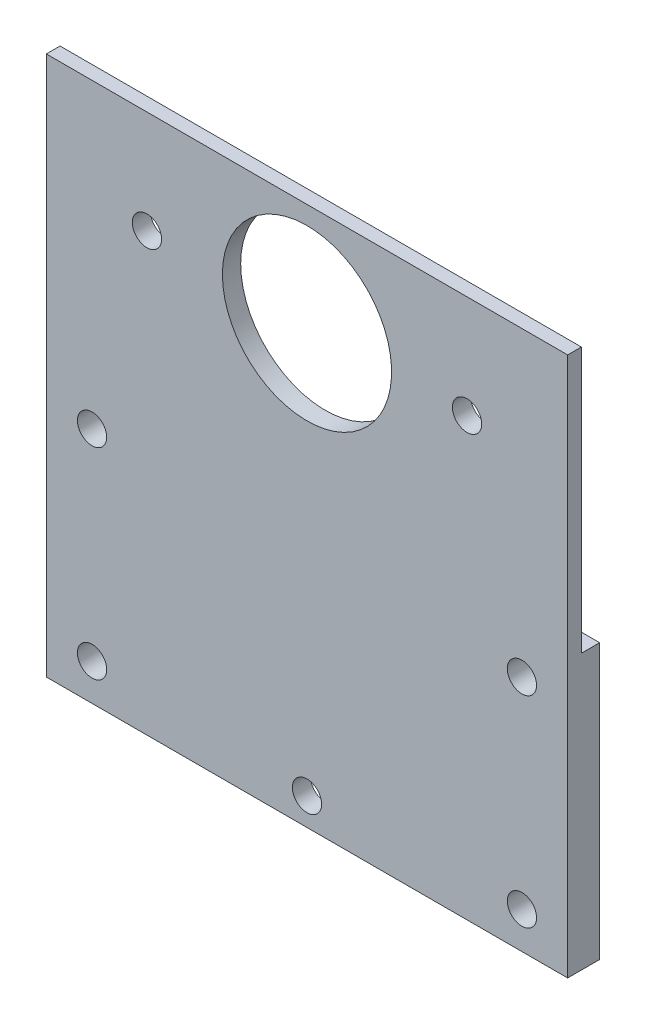
from build123d import *

# Parameters (mm, degrees)
GRUNDK_RPER_DEPTH               = 2
SKIZZE2_R                       = 9.25
SKIZZE2_R_2                     = 1.6000000000000008
BOHRUNGEN_KUGELROLLER_DEPTH     = 66.55341333599647
AUFSATZ_GETRIEBEHALTER_DEPTH    = 2
SKIZZE4_R                       = 1.6000000000000019
BOHRUNGEN_GETRIEBEHALTER_DEPTH  = 66.64487794184707
SKIZZE5_R                       = 1.6
BOHRUNG_HALTERUNG_DEPTH         = 66.55341333599647
SCHNITT_LINEAR_AUSTRAGEN4_DEPTH = 1
VERRUNDUNG_AUSSCHNITTE_R        = 1
VERRUNDUNG4_R                   = 1
FASE1_SIZE                      = 0.5


# Some blends are built 0.0001 mm under size
with BuildPart() as part:
    # Skizze1 → Grundkörper (new body)
    with BuildSketch(Plane.XY):
        Polygon((-28.500000000000004, 59), (28.500000000000004, 59), (28.500000000000007, 0), (-28.500000000000007, 0), align=None)
    extrude(amount=GRUNDK_RPER_DEPTH)

    # Skizze2 → Bohrungen_Kugelroller (cut, through all)
    with BuildSketch(Plane(origin=(0, 0, 0), x_dir=(-1, 0, 0), z_dir=(0, 0, -1))):
        with Locations((0, 47.75)):
            Circle(SKIZZE2_R)
        with Locations((-17.5, 47.75)):
            Circle(SKIZZE2_R_2)
        with Locations(Location((17.5, 47.75, 0), (0, 0, 180))):
            Circle(SKIZZE2_R_2)
    extrude(amount=-BOHRUNGEN_KUGELROLLER_DEPTH, mode=Mode.SUBTRACT)

    # Skizze3 → Aufsatz_Getriebehalter (add)
    with BuildSketch(Plane(origin=(0, 0, 0), x_dir=(-1, 0, 0), z_dir=(0, 0, -1))):
        Polygon((-28.500000000000007, 30), (-18.50000000000001, 30), (-18.500000000000007, 0), (-28.500000000000007, 0), align=None)
        Polygon((28.500000000000007, 0), (18.500000000000007, 0), (18.50000000000001, 30), (28.500000000000007, 30), align=None)
    extrude(amount=AUFSATZ_GETRIEBEHALTER_DEPTH)

    # Skizze4 → Bohrungen_Getriebehalter (cut, through all)
    with BuildSketch(Plane(origin=(0, 0, -2), x_dir=(-1, 0, 0), z_dir=(0, 0, -1))):
        with Locations((-23.500000000000007, 25.999999999999996)):
            Circle(SKIZZE4_R)
        with Locations(Location((23.500000000000014, 26.000000000000004, 0), (0, 0, 180))):
            Circle(SKIZZE4_R)
        with Locations((23.500000000000018, 4.000000000000007)):
            Circle(SKIZZE4_R)
        with Locations(Location((-23.500000000000004, 4.0000000000000036, 0), (0, 0, 180))):
            Circle(SKIZZE4_R)
    extrude(amount=-BOHRUNGEN_GETRIEBEHALTER_DEPTH, mode=Mode.SUBTRACT)

    # Skizze5 → Bohrung_Halterung (cut, through all)
    with BuildSketch(Plane(origin=(0, 0, 0), x_dir=(-1, 0, 0), z_dir=(0, 0, -1))):
        with Locations((7.14e-15, 3.0000000000000027)):
            Circle(SKIZZE5_R)
    extrude(amount=-BOHRUNG_HALTERUNG_DEPTH, mode=Mode.SUBTRACT)

    # Skizze8 → Schnitt-Linear austragen4 (cut)
    with BuildSketch(Plane(origin=(0, 0, 0), x_dir=(-1, 0, 0), z_dir=(0, 0, -1))):
        Polygon((-16.500000000000007, 13.000000000000002), (-16.500000000000007, 3), (-4, 3), (-4, 7.500000000000002), align=None)
        Polygon((-4, 9.500000000000002), (-4, 20.5), (-16.500000000000004, 15.000000000000002), align=None)
        Polygon((-16.500000000000007, 28), (-16.500000000000007, 17), (-4.000000000000002, 22.500000000000007), align=None)
        Polygon((-16.500000000000007, 30), (-4.000000000000005, 24.500000000000007), (-4.000000000000005, 35.50000000000001), align=None)
        Polygon((-26.17803843608435, 32), (-16.500000000000007, 32), (-4.000000000000005, 37.50000000000001), (-26.17803843608435, 37.50000000000001), align=None)
        Polygon((26.17803843608435, 37.50000000000001), (26.17803843608435, 32), (16.500000000000007, 32), (4.000000000000005, 37.50000000000001), align=None)
        Polygon((4.000000000000005, 35.50000000000001), (16.500000000000007, 30), (4.000000000000005, 24.500000000000007), align=None)
        Polygon((4.000000000000002, 22.500000000000007), (16.500000000000007, 28), (16.500000000000007, 17), align=None)
        Polygon((16.500000000000004, 15.000000000000002), (4, 9.500000000000002), (4, 20.5), align=None)
        Polygon((4, 7.500000000000002), (16.500000000000007, 13.000000000000002), (16.500000000000007, 3), (4, 3), align=None)
    extrude(amount=-SCHNITT_LINEAR_AUSTRAGEN4_DEPTH, mode=Mode.SUBTRACT)

    # Verrundung_Ausschnitte
    verrundung_ausschnitte_edges = [part.edges().sort_by_distance(p)[0] for p in [
        (-26.17803843608435, 34.75, 1),
        (-21.33901921804218, 32, 1),
        (-10.250000000000007, 34.75, 1),
        (-15.089019218042177, 37.50000000000001, 1),
        (-10.250000000000007, 32.75, 1),
        (-10.250000000000007, 27.250000000000004, 1),
        (-4.000000000000005, 30.000000000000007, 1),
        (-10.250000000000004, 25.250000000000004, 1),
        (-16.500000000000007, 22.5, 1),
        (-10.250000000000004, 19.750000000000004, 1),
        (-10.250000000000002, 12.250000000000002, 1),
        (-4, 15, 1),
        (-10.250000000000002, 17.75, 1),
        (-10.250000000000004, 10.250000000000002, 1),
        (-16.500000000000007, 8, 1),
        (-10.250000000000004, 3, 1),
        (-4, 5.250000000000001, 1),
        (4, 5.250000000000001, 1),
        (10.250000000000004, 3, 1),
        (16.500000000000007, 8, 1),
        (10.250000000000004, 10.250000000000002, 1),
        (10.250000000000002, 17.75, 1),
        (4, 15, 1),
        (10.250000000000002, 12.250000000000002, 1),
        (10.250000000000004, 19.750000000000004, 1),
        (16.500000000000007, 22.5, 1),
        (10.250000000000004, 25.250000000000004, 1),
        (4.000000000000005, 30.000000000000007, 1),
        (10.250000000000007, 27.250000000000004, 1),
        (10.250000000000007, 32.75, 1),
        (10.250000000000007, 34.75, 1),
        (21.33901921804218, 32, 1),
        (26.17803843608435, 34.75, 1),
        (15.089019218042177, 37.50000000000001, 1),
    ]]
    fillet(verrundung_ausschnitte_edges, radius=VERRUNDUNG_AUSSCHNITTE_R - 0.0001)  # a hair under: the kernel refuses the full size

    # Verrundung4
    # the kernel refuses this fillet: 1 mm, written as the material it adds along each edge
    with BuildSketch(Plane(origin=(-16.710272778863217, 33, 1), x_dir=(0, -1, 0), z_dir=(-1, 0, 0))) as verrundung4_piece_1:
        with BuildLine():
            CenterArc((9.999999999999e-05, -0.9999), 0.9999, 0, 90)
            Line((1, -0.9999), (1, 0))
            Line((1, 0), (9.999999999999e-05, 0))
        make_face()
    revolve(axis=Axis((-16.710272778863217, 33, 1), (0, 0, 1)), revolution_arc=23.749494492866784)
    with BuildSketch(Plane(origin=(-8.755727324317757, 36.50000000000001, 1), x_dir=(0.4027386142660173, -0.9153150324227655, 0), z_dir=(-0.9153150324227655, -0.4027386142660173, 0))) as verrundung4_piece_2:
        with BuildLine():
            CenterArc((9.999999999999e-05, -0.9999), 0.9999, 0, 90)
            Line((1, -0.9999), (1, 0))
            Line((1, 0), (9.999999999999e-05, 0))
        make_face()
    revolve(axis=Axis((-8.755727324317757, 36.50000000000001, 1), (0, 0, 1)), revolution_arc=156.25050550713323)
    with BuildSketch(Plane(origin=(-25.17803843608435, 33, 1), x_dir=(-1, 0, 0), z_dir=(0, 1, 0))) as verrundung4_piece_3:
        with BuildLine():
            CenterArc((9.999999999999e-05, -0.9999), 0.9999, 0, 90)
            Line((1, -0.9999), (1, 0))
            Line((1, 0), (9.999999999999e-05, 0))
        make_face()
    revolve(axis=Axis((-25.17803843608435, 33, 1), (0, 0, 1)), revolution_arc=90)
    with BuildSketch(Plane(origin=(-25.17803843608435, 36.50000000000001, 1), x_dir=(0, 1, 0), z_dir=(1, 0, 0))) as verrundung4_piece_4:
        with BuildLine():
            CenterArc((9.999999999999e-05, -0.9999), 0.9999, 0, 90)
            Line((1, -0.9999), (1, 0))
            Line((1, 0), (9.999999999999e-05, 0))
        make_face()
    revolve(axis=Axis((-25.17803843608435, 36.50000000000001, 1), (0, 0, 1)), revolution_arc=90)
    with BuildSketch(Plane(origin=(-5.000000000000005, 26.03252002269982, 1), x_dir=(-0.4027386142660164, -0.9153150324227659, 0), z_dir=(-0.9153150324227659, 0.4027386142660164, 0))) as verrundung4_piece_5:
        with BuildLine():
            CenterArc((9.999999999999e-05, -0.9999), 0.9999, 0, 90)
            Line((1, -0.9999), (1, 0))
            Line((1, 0), (9.999999999999e-05, 0))
        make_face()
    revolve(axis=Axis((-5.000000000000005, 26.03252002269982, 1), (0, 0, 1)), revolution_arc=113.74949449286673)
    with BuildSketch(Plane(origin=(-14.016999948409522, 30, 1), x_dir=(-0.4027386142660173, 0.9153150324227655, 0), z_dir=(0.9153150324227655, 0.4027386142660173, 0))) as verrundung4_piece_6:
        with BuildLine():
            CenterArc((9.999999999999e-05, -0.9999), 0.9999, 0, 90)
            Line((1, -0.9999), (1, 0))
            Line((1, 0), (9.999999999999e-05, 0))
        make_face()
    revolve(axis=Axis((-14.016999948409522, 30, 1), (0, 0, 1)), revolution_arc=132.5010110142665)
    with BuildSketch(Plane(origin=(-5.000000000000005, 33.967479977300194, 1), x_dir=(1, 0, 0), z_dir=(0, -1, 0))) as verrundung4_piece_7:
        with BuildLine():
            CenterArc((9.999999999999e-05, -0.9999), 0.9999, 0, 90)
            Line((1, -0.9999), (1, 0))
            Line((1, 0), (9.999999999999e-05, 0))
        make_face()
    revolve(axis=Axis((-5.000000000000005, 33.967479977300194, 1), (0, 0, 1)), revolution_arc=113.74949449286679)
    with BuildSketch(Plane(origin=(-15.500000000000005, 18.532520022699813, 1), x_dir=(-1, 0, 0), z_dir=(0, 1, 0))) as verrundung4_piece_8:
        with BuildLine():
            CenterArc((9.999999999999e-05, -0.9999), 0.9999, 0, 90)
            Line((1, -0.9999), (1, 0))
            Line((1, 0), (9.999999999999e-05, 0))
        make_face()
    revolve(axis=Axis((-15.500000000000005, 18.532520022699813, 1), (0, 0, 1)), revolution_arc=113.74949449286679)
    with BuildSketch(Plane(origin=(-15.500000000000007, 26.467479977300187, 1), x_dir=(0.4027386142660163, 0.9153150324227659, 0), z_dir=(0.9153150324227659, -0.4027386142660163, 0))) as verrundung4_piece_9:
        with BuildLine():
            CenterArc((9.999999999999e-05, -0.9999), 0.9999, 0, 90)
            Line((1, -0.9999), (1, 0))
            Line((1, 0), (9.999999999999e-05, 0))
        make_face()
    revolve(axis=Axis((-15.500000000000007, 26.467479977300187, 1), (0, 0, 1)), revolution_arc=113.74949449286673)
    with BuildSketch(Plane(origin=(-6.4830000515904835, 22.500000000000007, 1), x_dir=(0.4027386142660172, -0.9153150324227656, 0), z_dir=(-0.9153150324227656, -0.4027386142660172, 0))) as verrundung4_piece_10:
        with BuildLine():
            CenterArc((9.999999999999e-05, -0.9999), 0.9999, 0, 90)
            Line((1, -0.9999), (1, 0))
            Line((1, 0), (9.999999999999e-05, 0))
        make_face()
    revolve(axis=Axis((-6.4830000515904835, 22.500000000000007, 1), (0, 0, 1)), revolution_arc=132.5010110142665)
    with BuildSketch(Plane(origin=(-5, 18.96747997730019, 1), x_dir=(1, 0, 0), z_dir=(0, -1, 0))) as verrundung4_piece_11:
        with BuildLine():
            CenterArc((9.999999999999e-05, -0.9999), 0.9999, 0, 90)
            Line((1, -0.9999), (1, 0))
            Line((1, 0), (9.999999999999e-05, 0))
        make_face()
    revolve(axis=Axis((-5, 18.96747997730019, 1), (0, 0, 1)), revolution_arc=113.74949449286675)
    with BuildSketch(Plane(origin=(-5, 11.032520022699815, 1), x_dir=(-0.40273861426601676, -0.9153150324227657, 0), z_dir=(-0.9153150324227657, 0.40273861426601676, 0))) as verrundung4_piece_12:
        with BuildLine():
            CenterArc((9.999999999999e-05, -0.9999), 0.9999, 0, 90)
            Line((1, -0.9999), (1, 0))
            Line((1, 0), (9.999999999999e-05, 0))
        make_face()
    revolve(axis=Axis((-5, 11.032520022699815, 1), (0, 0, 1)), revolution_arc=113.74949449286676)
    with BuildSketch(Plane(origin=(-14.016999948409518, 15.000000000000002, 1), x_dir=(-0.4027386142660167, 0.9153150324227658, 0), z_dir=(0.9153150324227658, 0.4027386142660167, 0))) as verrundung4_piece_13:
        with BuildLine():
            CenterArc((9.999999999999e-05, -0.9999), 0.9999, 0, 90)
            Line((1, -0.9999), (1, 0))
            Line((1, 0), (9.999999999999e-05, 0))
        make_face()
    revolve(axis=Axis((-14.016999948409518, 15.000000000000002, 1), (0, 0, 1)), revolution_arc=132.5010110142665)
    with BuildSketch(Plane(origin=(-15.500000000000007, 4, 1), x_dir=(-1, 0, 0), z_dir=(0, 1, 0))) as verrundung4_piece_14:
        with BuildLine():
            CenterArc((9.999999999999e-05, -0.9999), 0.9999, 0, 90)
            Line((1, -0.9999), (1, 0))
            Line((1, 0), (9.999999999999e-05, 0))
        make_face()
    revolve(axis=Axis((-15.500000000000007, 4, 1), (0, 0, 1)), revolution_arc=90)
    with BuildSketch(Plane(origin=(-5, 4, 1), x_dir=(0, -1, 0), z_dir=(-1, 0, 0))) as verrundung4_piece_15:
        with BuildLine():
            CenterArc((9.999999999999e-05, -0.9999), 0.9999, 0, 90)
            Line((1, -0.9999), (1, 0))
            Line((1, 0), (9.999999999999e-05, 0))
        make_face()
    revolve(axis=Axis((-5, 4, 1), (0, 0, 1)), revolution_arc=90)
    with BuildSketch(Plane(origin=(-15.500000000000007, 11.46747997730019, 1), x_dir=(0.40273861426601665, 0.9153150324227657, 0), z_dir=(0.9153150324227657, -0.40273861426601665, 0))) as verrundung4_piece_16:
        with BuildLine():
            CenterArc((9.999999999999e-05, -0.9999), 0.9999, 0, 90)
            Line((1, -0.9999), (1, 0))
            Line((1, 0), (9.999999999999e-05, 0))
        make_face()
    revolve(axis=Axis((-15.500000000000007, 11.46747997730019, 1), (0, 0, 1)), revolution_arc=113.74949449286675)
    with BuildSketch(Plane(origin=(-5, 6.847479977300189, 1), x_dir=(1, 0, 0), z_dir=(0, -1, 0))) as verrundung4_piece_17:
        with BuildLine():
            CenterArc((9.999999999999e-05, -0.9999), 0.9999, 0, 90)
            Line((1, -0.9999), (1, 0))
            Line((1, 0), (9.999999999999e-05, 0))
        make_face()
    revolve(axis=Axis((-5, 6.847479977300189, 1), (0, 0, 1)), revolution_arc=66.25050550713325)
    with BuildSketch(Plane(origin=(15.500000000000007, 4, 1), x_dir=(0, -1, 0), z_dir=(-1, 0, 0))) as verrundung4_piece_18:
        with BuildLine():
            CenterArc((9.999999999999e-05, -0.9999), 0.9999, 0, 90)
            Line((1, -0.9999), (1, 0))
            Line((1, 0), (9.999999999999e-05, 0))
        make_face()
    revolve(axis=Axis((15.500000000000007, 4, 1), (0, 0, 1)), revolution_arc=90)
    with BuildSketch(Plane(origin=(15.500000000000007, 11.46747997730019, 1), x_dir=(1, 0, 0), z_dir=(0, -1, 0))) as verrundung4_piece_19:
        with BuildLine():
            CenterArc((9.999999999999e-05, -0.9999), 0.9999, 0, 90)
            Line((1, -0.9999), (1, 0))
            Line((1, 0), (9.999999999999e-05, 0))
        make_face()
    revolve(axis=Axis((15.500000000000007, 11.46747997730019, 1), (0, 0, 1)), revolution_arc=113.74949449286675)
    with BuildSketch(Plane(origin=(5, 4, 1), x_dir=(-1, 0, 0), z_dir=(0, 1, 0))) as verrundung4_piece_20:
        with BuildLine():
            CenterArc((9.999999999999e-05, -0.9999), 0.9999, 0, 90)
            Line((1, -0.9999), (1, 0))
            Line((1, 0), (9.999999999999e-05, 0))
        make_face()
    revolve(axis=Axis((5, 4, 1), (0, 0, 1)), revolution_arc=90)
    with BuildSketch(Plane(origin=(5.000000000000001, 6.847479977300189, 1), x_dir=(-0.40273861426601665, 0.9153150324227657, 0), z_dir=(0.9153150324227657, 0.40273861426601665, 0))) as verrundung4_piece_21:
        with BuildLine():
            CenterArc((9.999999999999e-05, -0.9999), 0.9999, 0, 90)
            Line((1, -0.9999), (1, 0))
            Line((1, 0), (9.999999999999e-05, 0))
        make_face()
    revolve(axis=Axis((5.000000000000001, 6.847479977300189, 1), (0, 0, 1)), revolution_arc=66.25050550713325)
    with BuildSketch(Plane(origin=(5, 11.032520022699815, 1), x_dir=(-1, 0, 0), z_dir=(0, 1, 0))) as verrundung4_piece_22:
        with BuildLine():
            CenterArc((9.999999999999e-05, -0.9999), 0.9999, 0, 90)
            Line((1, -0.9999), (1, 0))
            Line((1, 0), (9.999999999999e-05, 0))
        make_face()
    revolve(axis=Axis((5, 11.032520022699815, 1), (0, 0, 1)), revolution_arc=113.74949449286676)
    with BuildSketch(Plane(origin=(5, 18.967479977300187, 1), x_dir=(0.4027386142660167, 0.9153150324227658, 0), z_dir=(0.9153150324227658, -0.4027386142660167, 0))) as verrundung4_piece_23:
        with BuildLine():
            CenterArc((9.999999999999e-05, -0.9999), 0.9999, 0, 90)
            Line((1, -0.9999), (1, 0))
            Line((1, 0), (9.999999999999e-05, 0))
        make_face()
    revolve(axis=Axis((5, 18.967479977300187, 1), (0, 0, 1)), revolution_arc=113.74949449286675)
    with BuildSketch(Plane(origin=(14.016999948409518, 15.000000000000002, 1), x_dir=(0.40273861426601676, -0.9153150324227657, 0), z_dir=(-0.9153150324227657, -0.40273861426601676, 0))) as verrundung4_piece_24:
        with BuildLine():
            CenterArc((9.999999999999e-05, -0.9999), 0.9999, 0, 90)
            Line((1, -0.9999), (1, 0))
            Line((1, 0), (9.999999999999e-05, 0))
        make_face()
    revolve(axis=Axis((14.016999948409518, 15.000000000000002, 1), (0, 0, 1)), revolution_arc=132.5010110142665)
    with BuildSketch(Plane(origin=(15.500000000000007, 26.467479977300187, 1), x_dir=(1, 0, 0), z_dir=(0, -1, 0))) as verrundung4_piece_25:
        with BuildLine():
            CenterArc((9.999999999999e-05, -0.9999), 0.9999, 0, 90)
            Line((1, -0.9999), (1, 0))
            Line((1, 0), (9.999999999999e-05, 0))
        make_face()
    revolve(axis=Axis((15.500000000000007, 26.467479977300187, 1), (0, 0, 1)), revolution_arc=113.74949449286673)
    with BuildSketch(Plane(origin=(15.500000000000007, 18.532520022699813, 1), x_dir=(-0.4027386142660172, -0.9153150324227656, 0), z_dir=(-0.9153150324227656, 0.4027386142660172, 0))) as verrundung4_piece_26:
        with BuildLine():
            CenterArc((9.999999999999e-05, -0.9999), 0.9999, 0, 90)
            Line((1, -0.9999), (1, 0))
            Line((1, 0), (9.999999999999e-05, 0))
        make_face()
    revolve(axis=Axis((15.500000000000007, 18.532520022699813, 1), (0, 0, 1)), revolution_arc=113.74949449286679)
    with BuildSketch(Plane(origin=(6.4830000515904835, 22.500000000000007, 1), x_dir=(-0.4027386142660163, 0.9153150324227659, 0), z_dir=(0.9153150324227659, 0.4027386142660163, 0))) as verrundung4_piece_27:
        with BuildLine():
            CenterArc((9.999999999999e-05, -0.9999), 0.9999, 0, 90)
            Line((1, -0.9999), (1, 0))
            Line((1, 0), (9.999999999999e-05, 0))
        make_face()
    revolve(axis=Axis((6.4830000515904835, 22.500000000000007, 1), (0, 0, 1)), revolution_arc=132.5010110142665)
    with BuildSketch(Plane(origin=(14.016999948409522, 30, 1), x_dir=(0.4027386142660164, -0.9153150324227659, 0), z_dir=(-0.9153150324227659, -0.4027386142660164, 0))) as verrundung4_piece_28:
        with BuildLine():
            CenterArc((9.999999999999e-05, -0.9999), 0.9999, 0, 90)
            Line((1, -0.9999), (1, 0))
            Line((1, 0), (9.999999999999e-05, 0))
        make_face()
    revolve(axis=Axis((14.016999948409522, 30, 1), (0, 0, 1)), revolution_arc=132.5010110142665)
    with BuildSketch(Plane(origin=(5.000000000000003, 26.032520022699817, 1), x_dir=(-1, 0, 0), z_dir=(0, 1, 0))) as verrundung4_piece_29:
        with BuildLine():
            CenterArc((9.999999999999e-05, -0.9999), 0.9999, 0, 90)
            Line((1, -0.9999), (1, 0))
            Line((1, 0), (9.999999999999e-05, 0))
        make_face()
    revolve(axis=Axis((5.000000000000003, 26.032520022699817, 1), (0, 0, 1)), revolution_arc=113.74949449286673)
    with BuildSketch(Plane(origin=(5.000000000000005, 33.967479977300194, 1), x_dir=(0.4027386142660173, 0.9153150324227655, 0), z_dir=(0.9153150324227655, -0.4027386142660173, 0))) as verrundung4_piece_30:
        with BuildLine():
            CenterArc((9.999999999999e-05, -0.9999), 0.9999, 0, 90)
            Line((1, -0.9999), (1, 0))
            Line((1, 0), (9.999999999999e-05, 0))
        make_face()
    revolve(axis=Axis((5.000000000000005, 33.967479977300194, 1), (0, 0, 1)), revolution_arc=113.74949449286679)
    with BuildSketch(Plane(origin=(25.17803843608435, 33, 1), x_dir=(0, -1, 0), z_dir=(-1, 0, 0))) as verrundung4_piece_31:
        with BuildLine():
            CenterArc((9.999999999999e-05, -0.9999), 0.9999, 0, 90)
            Line((1, -0.9999), (1, 0))
            Line((1, 0), (9.999999999999e-05, 0))
        make_face()
    revolve(axis=Axis((25.17803843608435, 33, 1), (0, 0, 1)), revolution_arc=90)
    with BuildSketch(Plane(origin=(25.17803843608435, 36.50000000000001, 1), x_dir=(1, 0, 0), z_dir=(0, -1, 0))) as verrundung4_piece_32:
        with BuildLine():
            CenterArc((9.999999999999e-05, -0.9999), 0.9999, 0, 90)
            Line((1, -0.9999), (1, 0))
            Line((1, 0), (9.999999999999e-05, 0))
        make_face()
    revolve(axis=Axis((25.17803843608435, 36.50000000000001, 1), (0, 0, 1)), revolution_arc=90)
    with BuildSketch(Plane(origin=(16.710272778863217, 33, 1), x_dir=(-0.4027386142660173, -0.9153150324227655, 0), z_dir=(-0.9153150324227655, 0.4027386142660173, 0))) as verrundung4_piece_33:
        with BuildLine():
            CenterArc((9.999999999999e-05, -0.9999), 0.9999, 0, 90)
            Line((1, -0.9999), (1, 0))
            Line((1, 0), (9.999999999999e-05, 0))
        make_face()
    revolve(axis=Axis((16.710272778863217, 33, 1), (0, 0, 1)), revolution_arc=23.749494492866784)
    with BuildSketch(Plane(origin=(8.755727324317757, 36.50000000000001, 1), x_dir=(0, 1, 0), z_dir=(1, 0, 0))) as verrundung4_piece_34:
        with BuildLine():
            CenterArc((9.999999999999e-05, -0.9999), 0.9999, 0, 90)
            Line((1, -0.9999), (1, 0))
            Line((1, 0), (9.999999999999e-05, 0))
        make_face()
    revolve(axis=Axis((8.755727324317757, 36.50000000000001, 1), (0, 0, 1)), revolution_arc=156.25050550713323)
    with BuildSketch(Plane(origin=(4.000000000000005, 37.50000000000001, 0), x_dir=(0.9153150324227651, -0.4027386142660177, 0), z_dir=(0, 0, 1))) as verrundung4_piece_35:
        with BuildLine():
            CenterArc((VERRUNDUNG4_R * 4.75572732432, VERRUNDUNG4_R), VERRUNDUNG4_R, 113.74949449286683, 156.25050550713325)
            Line((VERRUNDUNG4_R * 4.35298871005, VERRUNDUNG4_R * 1.91531503242), (0, 0))
            Line((0, 0), (VERRUNDUNG4_R * 4.75572732432, 4e-17))
        make_face()
    extrude(amount=1.0000000000000002)
    with BuildSketch(Plane(origin=(16.500000000000007, 32, 0), x_dir=(1, 0, 0), z_dir=(0, 0, 1))) as verrundung4_piece_36:
        with BuildLine():
            CenterArc((VERRUNDUNG4_R * 0.210272778863, VERRUNDUNG4_R), VERRUNDUNG4_R, 246.25050550713328, 23.74949449286669)
            Line((-VERRUNDUNG4_R * 0.192465835403, VERRUNDUNG4_R * 0.0846849675772), (0, 0))
            Line((0, 0), (VERRUNDUNG4_R * 0.210272778863, 0))
        make_face()
    extrude(amount=1.0000000000000002)
    with BuildSketch(Plane(origin=(26.17803843608435, 37.50000000000001, 0), x_dir=(-1, 0, 0), z_dir=(0, 0, 1)), Plane(origin=(-26.17803843608435, 32, 0), x_dir=(1, 0, 0), z_dir=(0, 0, 1))) as verrundung4_piece_37:
        with BuildLine():
            CenterArc((VERRUNDUNG4_R, VERRUNDUNG4_R), VERRUNDUNG4_R, 180, 90)
            Line((0, VERRUNDUNG4_R), (0, 0))
            Line((0, 0), (VERRUNDUNG4_R, 0))
        make_face()
    extrude(amount=1.0000000000000002)
    with BuildSketch(Plane(origin=(26.17803843608435, 32, 0), x_dir=(-1, 0, 0), z_dir=(0, 0, 1)), Plane(origin=(-26.17803843608435, 37.50000000000001, 0), x_dir=(1, 0, 0), z_dir=(0, 0, 1))) as verrundung4_piece_38:
        with BuildLine():
            CenterArc((VERRUNDUNG4_R, -VERRUNDUNG4_R), VERRUNDUNG4_R, 90, 90)
            Line((0, -VERRUNDUNG4_R), (0, 0))
            Line((0, 0), (VERRUNDUNG4_R, 0))
        make_face()
    extrude(amount=1.0000000000000002)
    with BuildSketch(Plane(origin=(4.000000000000005, 35.50000000000001, 0), x_dir=(0, -1, 0), z_dir=(0, 0, 1))) as verrundung4_piece_39:
        with BuildLine():
            CenterArc((VERRUNDUNG4_R * 1.5325200227, VERRUNDUNG4_R), VERRUNDUNG4_R, 156.25050550713348, 113.74949449286652)
            Line((VERRUNDUNG4_R * 0.617204990277, VERRUNDUNG4_R * 1.40273861427), (0, 0))
            Line((0, 0), (VERRUNDUNG4_R * 1.5325200227, 0))
        make_face()
    extrude(amount=1.0000000000000002)
    with BuildSketch(Plane(origin=(4.000000000000005, 24.500000000000007, 0), x_dir=(0.9153150324227658, 0.4027386142660163, 0), z_dir=(0, 0, 1))) as verrundung4_piece_40:
        with BuildLine():
            CenterArc((VERRUNDUNG4_R * 1.5325200227, VERRUNDUNG4_R), VERRUNDUNG4_R, 156.25050550713308, 113.74949449286697)
            Line((VERRUNDUNG4_R * 0.617204990277, VERRUNDUNG4_R * 1.40273861427), (0, 0))
            Line((0, 0), (VERRUNDUNG4_R * 1.5325200227, -2e-17))
        make_face()
    extrude(amount=1.0000000000000002)
    with BuildSketch(Plane(origin=(16.500000000000007, 30, 0), x_dir=(-0.9153150324227658, -0.4027386142660163, 0), z_dir=(0, 0, 1))) as verrundung4_piece_41:
        with BuildLine():
            CenterArc((VERRUNDUNG4_R * 2.27272727273, -VERRUNDUNG4_R), VERRUNDUNG4_R, 90.00000000000006, 132.5010110142665)
            Line((VERRUNDUNG4_R * 1.53546185718, -VERRUNDUNG4_R * 1.67560321716), (0, 0))
            Line((0, 0), (VERRUNDUNG4_R * 2.27272727273, -2e-17))
        make_face()
    extrude(amount=1.0000000000000002)
    with BuildSketch(Plane(origin=(4.000000000000002, 22.500000000000007, 0), x_dir=(0.9153150324227655, -0.40273861426601687, 0), z_dir=(0, 0, 1))) as verrundung4_piece_42:
        with BuildLine():
            CenterArc((VERRUNDUNG4_R * 2.27272727273, VERRUNDUNG4_R), VERRUNDUNG4_R, 137.49898898573335, 132.50101101426662)
            Line((VERRUNDUNG4_R * 1.53546185718, VERRUNDUNG4_R * 1.67560321716), (0, 0))
            Line((0, 0), (VERRUNDUNG4_R * 2.27272727273, 1e-16))
        make_face()
    extrude(amount=1.0000000000000002)
    with BuildSketch(Plane(origin=(16.500000000000007, 17, 0), x_dir=(0, 1, 0), z_dir=(0, 0, 1))) as verrundung4_piece_43:
        with BuildLine():
            CenterArc((VERRUNDUNG4_R * 1.5325200227, VERRUNDUNG4_R), VERRUNDUNG4_R, 156.2505055071331, 113.74949449286689)
            Line((VERRUNDUNG4_R * 0.617204990277, VERRUNDUNG4_R * 1.40273861427), (0, 0))
            Line((0, 0), (VERRUNDUNG4_R * 1.5325200227, 0))
        make_face()
    extrude(amount=1.0000000000000002)
    with BuildSketch(Plane(origin=(16.500000000000007, 28, 0), x_dir=(0, -1, 0), z_dir=(0, 0, 1))) as verrundung4_piece_44:
        with BuildLine():
            CenterArc((VERRUNDUNG4_R * 1.5325200227, -VERRUNDUNG4_R), VERRUNDUNG4_R, 90, 113.74949449286677)
            Line((VERRUNDUNG4_R * 0.617204990277, -VERRUNDUNG4_R * 1.40273861427), (0, 0))
            Line((0, 0), (VERRUNDUNG4_R * 1.5325200227, 0))
        make_face()
    extrude(amount=1.0000000000000002)
    with BuildSketch(Plane(origin=(16.500000000000004, 15.000000000000002, 0), x_dir=(-0.9153150324227656, 0.402738614266017, 0), z_dir=(0, 0, 1))) as verrundung4_piece_45:
        with BuildLine():
            CenterArc((VERRUNDUNG4_R * 2.27272727273, VERRUNDUNG4_R), VERRUNDUNG4_R, 137.49898898573352, 132.5010110142665)
            Line((VERRUNDUNG4_R * 1.53546185718, VERRUNDUNG4_R * 1.67560321716), (0, 0))
            Line((0, 0), (VERRUNDUNG4_R * 2.27272727273, 4e-17))
        make_face()
    extrude(amount=1.0000000000000002)
    with BuildSketch(Plane(origin=(4, 20.5, 0), x_dir=(0, -1, 0), z_dir=(0, 0, 1))) as verrundung4_piece_46:
        with BuildLine():
            CenterArc((VERRUNDUNG4_R * 1.5325200227, VERRUNDUNG4_R), VERRUNDUNG4_R, 156.25050550713325, 113.74949449286675)
            Line((VERRUNDUNG4_R * 0.617204990277, VERRUNDUNG4_R * 1.40273861427), (0, 0))
            Line((0, 0), (VERRUNDUNG4_R * 1.5325200227, 0))
        make_face()
    extrude(amount=1.0000000000000002)
    with BuildSketch(Plane(origin=(4, 9.500000000000002, 0), x_dir=(0, 1, 0), z_dir=(0, 0, 1))) as verrundung4_piece_47:
        with BuildLine():
            CenterArc((VERRUNDUNG4_R * 1.5325200227, -VERRUNDUNG4_R), VERRUNDUNG4_R, 90, 113.74949449286666)
            Line((VERRUNDUNG4_R * 0.617204990277, -VERRUNDUNG4_R * 1.40273861427), (0, 0))
            Line((0, 0), (VERRUNDUNG4_R * 1.5325200227, 0))
        make_face()
    extrude(amount=1.0000000000000002)
    with BuildSketch(Plane(origin=(4, 7.500000000000002, 0), x_dir=(0.9153150324227658, 0.4027386142660167, 0), z_dir=(0, 0, 1))) as verrundung4_piece_48:
        with BuildLine():
            CenterArc((VERRUNDUNG4_R * 0.6525200227, -VERRUNDUNG4_R), VERRUNDUNG4_R, 90.00000000000003, 66.25050550713323)
            Line((-VERRUNDUNG4_R * 0.262795009723, -VERRUNDUNG4_R * 0.597261385734), (0, 0))
            Line((0, 0), (VERRUNDUNG4_R * 0.6525200227, 1e-17))
        make_face()
    extrude(amount=1.0000000000000002)
    with BuildSketch(Plane(origin=(4, 3, 0), x_dir=(1, 0, 0), z_dir=(0, 0, 1))) as verrundung4_piece_49:
        with BuildLine():
            CenterArc((VERRUNDUNG4_R, VERRUNDUNG4_R), VERRUNDUNG4_R, 180, 90)
            Line((0, VERRUNDUNG4_R), (0, 0))
            Line((0, 0), (VERRUNDUNG4_R, 0))
        make_face()
    extrude(amount=1.0000000000000002)
    with BuildSketch(Plane(origin=(16.500000000000007, 13.000000000000002, 0), x_dir=(0, -1, 0), z_dir=(0, 0, 1))) as verrundung4_piece_50:
        with BuildLine():
            CenterArc((VERRUNDUNG4_R * 1.5325200227, -VERRUNDUNG4_R), VERRUNDUNG4_R, 90, 113.74949449286689)
            Line((VERRUNDUNG4_R * 0.617204990277, -VERRUNDUNG4_R * 1.40273861427), (0, 0))
            Line((0, 0), (VERRUNDUNG4_R * 1.5325200227, 0))
        make_face()
    extrude(amount=1.0000000000000002)
    with BuildSketch(Plane(origin=(16.500000000000007, 3, 0), x_dir=(0, 1, 0), z_dir=(0, 0, 1))) as verrundung4_piece_51:
        with BuildLine():
            CenterArc((VERRUNDUNG4_R, VERRUNDUNG4_R), VERRUNDUNG4_R, 180, 90)
            Line((0, VERRUNDUNG4_R), (0, 0))
            Line((0, 0), (VERRUNDUNG4_R, 0))
        make_face()
    extrude(amount=1.0000000000000002)
    with BuildSketch(Plane(origin=(-4, 7.500000000000002, 0), x_dir=(0, -1, 0), z_dir=(0, 0, 1))) as verrundung4_piece_52:
        with BuildLine():
            CenterArc((VERRUNDUNG4_R * 0.6525200227, -VERRUNDUNG4_R), VERRUNDUNG4_R, 90, 66.25050550713331)
            Line((-VERRUNDUNG4_R * 0.262795009723, -VERRUNDUNG4_R * 0.597261385734), (0, 0))
            Line((0, 0), (VERRUNDUNG4_R * 0.6525200227, 0))
        make_face()
    extrude(amount=1.0000000000000002)
    with BuildSketch(Plane(origin=(-16.500000000000007, 13.000000000000002, 0), x_dir=(0, -1, 0), z_dir=(0, 0, 1))) as verrundung4_piece_53:
        with BuildLine():
            CenterArc((VERRUNDUNG4_R * 1.5325200227, VERRUNDUNG4_R), VERRUNDUNG4_R, 156.2505055071331, 113.74949449286689)
            Line((VERRUNDUNG4_R * 0.617204990277, VERRUNDUNG4_R * 1.40273861427), (0, 0))
            Line((0, 0), (VERRUNDUNG4_R * 1.5325200227, 0))
        make_face()
    extrude(amount=1.0000000000000002)
    with BuildSketch(Plane(origin=(-4, 3, 0), x_dir=(0, 1, 0), z_dir=(0, 0, 1))) as verrundung4_piece_54:
        with BuildLine():
            CenterArc((VERRUNDUNG4_R, VERRUNDUNG4_R), VERRUNDUNG4_R, 180, 90)
            Line((0, VERRUNDUNG4_R), (0, 0))
            Line((0, 0), (VERRUNDUNG4_R, 0))
        make_face()
    extrude(amount=1.0000000000000002)
    with BuildSketch(Plane(origin=(-16.500000000000007, 3, 0), x_dir=(1, 0, 0), z_dir=(0, 0, 1))) as verrundung4_piece_55:
        with BuildLine():
            CenterArc((VERRUNDUNG4_R, VERRUNDUNG4_R), VERRUNDUNG4_R, 180, 90)
            Line((0, VERRUNDUNG4_R), (0, 0))
            Line((0, 0), (VERRUNDUNG4_R, 0))
        make_face()
    extrude(amount=1.0000000000000002)
    with BuildSketch(Plane(origin=(-16.500000000000004, 15.000000000000002, 0), x_dir=(0.9153150324227656, 0.402738614266017, 0), z_dir=(0, 0, 1))) as verrundung4_piece_56:
        with BuildLine():
            CenterArc((VERRUNDUNG4_R * 2.27272727273, -VERRUNDUNG4_R), VERRUNDUNG4_R, 89.99999999999997, 132.5010110142665)
            Line((VERRUNDUNG4_R * 1.53546185718, -VERRUNDUNG4_R * 1.67560321716), (0, 0))
            Line((0, 0), (VERRUNDUNG4_R * 2.27272727273, -4e-17))
        make_face()
    extrude(amount=1.0000000000000002)
    with BuildSketch(Plane(origin=(-4, 9.500000000000002, 0), x_dir=(0, 1, 0), z_dir=(0, 0, 1))) as verrundung4_piece_57:
        with BuildLine():
            CenterArc((VERRUNDUNG4_R * 1.5325200227, VERRUNDUNG4_R), VERRUNDUNG4_R, 156.25050550713334, 113.74949449286666)
            Line((VERRUNDUNG4_R * 0.617204990277, VERRUNDUNG4_R * 1.40273861427), (0, 0))
            Line((0, 0), (VERRUNDUNG4_R * 1.5325200227, 0))
        make_face()
    extrude(amount=1.0000000000000002)
    with BuildSketch(Plane(origin=(-4, 20.5, 0), x_dir=(-0.9153150324227661, -0.4027386142660157, 0), z_dir=(0, 0, 1))) as verrundung4_piece_58:
        with BuildLine():
            CenterArc((VERRUNDUNG4_R * 1.5325200227, VERRUNDUNG4_R), VERRUNDUNG4_R, 156.2505055071331, 113.74949449286697)
            Line((VERRUNDUNG4_R * 0.617204990277, VERRUNDUNG4_R * 1.40273861427), (0, 0))
            Line((0, 0), (VERRUNDUNG4_R * 1.5325200227, -3e-17))
        make_face()
    extrude(amount=1.0000000000000002)
    with BuildSketch(Plane(origin=(-4.000000000000002, 22.500000000000007, 0), x_dir=(-0.9153150324227655, -0.40273861426601687, 0), z_dir=(0, 0, 1))) as verrundung4_piece_59:
        with BuildLine():
            CenterArc((VERRUNDUNG4_R * 2.27272727273, -VERRUNDUNG4_R), VERRUNDUNG4_R, 90.00000000000003, 132.50101101426662)
            Line((VERRUNDUNG4_R * 1.53546185718, -VERRUNDUNG4_R * 1.67560321716), (0, 0))
            Line((0, 0), (VERRUNDUNG4_R * 2.27272727273, -1e-16))
        make_face()
    extrude(amount=1.0000000000000002)
    with BuildSketch(Plane(origin=(-16.500000000000007, 28, 0), x_dir=(0, -1, 0), z_dir=(0, 0, 1))) as verrundung4_piece_60:
        with BuildLine():
            CenterArc((VERRUNDUNG4_R * 1.5325200227, VERRUNDUNG4_R), VERRUNDUNG4_R, 156.25050550713323, 113.74949449286677)
            Line((VERRUNDUNG4_R * 0.617204990277, VERRUNDUNG4_R * 1.40273861427), (0, 0))
            Line((0, 0), (VERRUNDUNG4_R * 1.5325200227, 0))
        make_face()
    extrude(amount=1.0000000000000002)
    with BuildSketch(Plane(origin=(-16.500000000000007, 17, 0), x_dir=(0.9153150324227654, 0.4027386142660172, 0), z_dir=(0, 0, 1))) as verrundung4_piece_61:
        with BuildLine():
            CenterArc((VERRUNDUNG4_R * 1.5325200227, VERRUNDUNG4_R), VERRUNDUNG4_R, 156.25050550713323, 113.7494944928668)
            Line((VERRUNDUNG4_R * 0.617204990277, VERRUNDUNG4_R * 1.40273861427), (0, 0))
            Line((0, 0), (VERRUNDUNG4_R * 1.5325200227, -4e-17))
        make_face()
    extrude(amount=1.0000000000000002)
    with BuildSketch(Plane(origin=(-4.000000000000005, 35.50000000000001, 0), x_dir=(0, -1, 0), z_dir=(0, 0, 1))) as verrundung4_piece_62:
        with BuildLine():
            CenterArc((VERRUNDUNG4_R * 1.5325200227, -VERRUNDUNG4_R), VERRUNDUNG4_R, 90, 113.74949449286652)
            Line((VERRUNDUNG4_R * 0.617204990277, -VERRUNDUNG4_R * 1.40273861427), (0, 0))
            Line((0, 0), (VERRUNDUNG4_R * 1.5325200227, 0))
        make_face()
    extrude(amount=1.0000000000000002)
    with BuildSketch(Plane(origin=(-16.500000000000007, 30, 0), x_dir=(0.9153150324227658, -0.4027386142660163, 0), z_dir=(0, 0, 1))) as verrundung4_piece_63:
        with BuildLine():
            CenterArc((VERRUNDUNG4_R * 2.27272727273, VERRUNDUNG4_R), VERRUNDUNG4_R, 137.49898898573343, 132.5010110142665)
            Line((VERRUNDUNG4_R * 1.53546185718, VERRUNDUNG4_R * 1.67560321716), (0, 0))
            Line((0, 0), (VERRUNDUNG4_R * 2.27272727273, 2e-17))
        make_face()
    extrude(amount=1.0000000000000002)
    with BuildSketch(Plane(origin=(-4.000000000000005, 24.500000000000007, 0), x_dir=(0, 1, 0), z_dir=(0, 0, 1))) as verrundung4_piece_64:
        with BuildLine():
            CenterArc((VERRUNDUNG4_R * 1.5325200227, VERRUNDUNG4_R), VERRUNDUNG4_R, 156.25050550713348, 113.74949449286652)
            Line((VERRUNDUNG4_R * 0.617204990277, VERRUNDUNG4_R * 1.40273861427), (0, 0))
            Line((0, 0), (VERRUNDUNG4_R * 1.5325200227, 0))
        make_face()
    extrude(amount=1.0000000000000002)
    with BuildSketch(Plane(origin=(-4.000000000000005, 37.50000000000001, 0), x_dir=(-1, 0, 0), z_dir=(0, 0, 1))) as verrundung4_piece_65:
        with BuildLine():
            CenterArc((VERRUNDUNG4_R * 4.75572732432, VERRUNDUNG4_R), VERRUNDUNG4_R, 113.74949449286672, 156.25050550713328)
            Line((VERRUNDUNG4_R * 4.35298871005, VERRUNDUNG4_R * 1.91531503242), (0, 0))
            Line((0, 0), (VERRUNDUNG4_R * 4.75572732432, 0))
        make_face()
    extrude(amount=1.0000000000000002)
    with BuildSketch(Plane(origin=(-16.500000000000007, 32, 0), x_dir=(0.9153150324227711, 0.40273861426600444, 0), z_dir=(0, 0, 1))) as verrundung4_piece_66:
        with BuildLine():
            CenterArc((VERRUNDUNG4_R * 0.210272778863, VERRUNDUNG4_R), VERRUNDUNG4_R, 246.250505507134, 23.74949449286669)
            Line((-VERRUNDUNG4_R * 0.192465835403, VERRUNDUNG4_R * 0.0846849675772), (0, 0))
            Line((0, 0), (VERRUNDUNG4_R * 0.210272778863, -1e-17))
        make_face()
    extrude(amount=1.0000000000000002)

    # Fase1
    fase1_edges = [part.edges().sort_by_distance(p)[0] for p in [
        (28.500000000000004, 44.5, 0),
        (28.500000000000007, 15, -2),
        (23.500000000000007, 0, -2),
        (18.500000000000007, 15, -2),
        (23.500000000000007, 30, -2),
        (0, 0, 0),
        (-28.500000000000007, 15, -2),
        (-23.500000000000007, 30, -2),
        (-18.500000000000007, 15, -2),
        (-23.500000000000007, 0, -2),
        (0, 59, 0),
        (-28.500000000000004, 44.5, 0),
    ]]
    chamfer(fase1_edges, length=FASE1_SIZE)


solid = part.part
